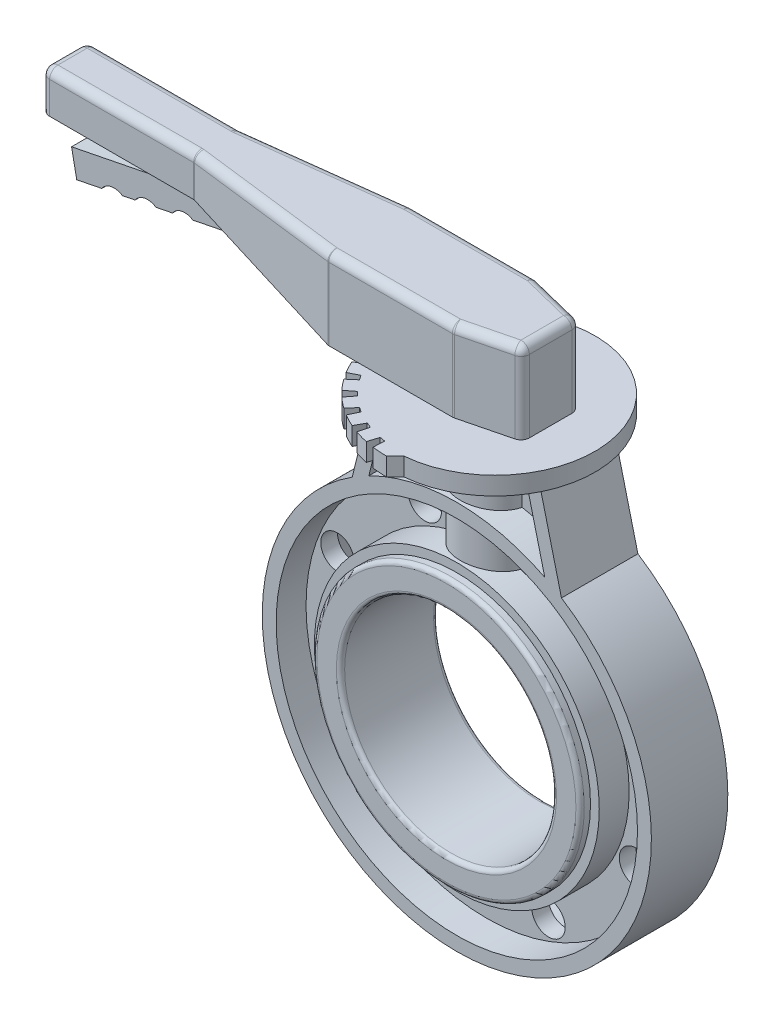
from build123d import *

# Parameters (mm, degrees)
CUT_EXTRUDE1_DEPTH       = 202.05969262883102
CUT_EXTRUDE1_DEPTH_BACK  = 202.05969262883102
SKETCH3_R                = 11.999999999999996
SKETCH3_R_2              = 12.000000000000002
SKETCH3_R_3              = 12.000000000000005
SKETCH5_R                = 72
SKETCH5_R_2              = 25
BOSS_EXTRUDE1_DEPTH      = 13
BOSS_EXTRUDE2_REACH      = 359.526
BOSS_EXTRUDE2_END_RADIUS = 102.50000000000001
SKETCH5_3_R              = 25
EXTRUDE_THIN1_DEPTH      = 27.5
EXTRUDE_THIN1_DEPTH_BACK = 27.5
BOSS_EXTRUDE3_DEPTH      = 5
FILLET1_R                = 3
BOSS_EXTRUDE4_DEPTH      = 13
CUT_EXTRUDE2_DEPTH       = 13
CIRPATTERN1_COUNT        = 7
CIRPATTERN1_ANGLE        = 70.00000000000016
BOSS_EXTRUDE5_DEPTH      = 58
CUT_EXTRUDE4_DEPTH       = 408.0479087281987
CUT_EXTRUDE4_DEPTH_BACK  = 408.0479087281987
BOSS_EXTRUDE6_DEPTH      = 6
FILLET2_R                = 6


with BuildPart() as part:
    # Sketch1 → Revolve1 (revolve)
    with BuildSketch(Plane(origin=(0, 0, 0), x_dir=(0, 0, -1), z_dir=(1, 0, 0)), mode=Mode.PRIVATE) as revolve1_sk:
        Polygon((-27.50000000000001, 82.49999999999999), (27.500000000000004, 82.50000000000001), (27.500000000000004, 102.50000000000001), (6.0000000000000036, 102.50000000000001), (6.0000000000000036, 130), (27.500000000000004, 130), (27.50000000000001, 140), (-27.50000000000001, 140), (-27.50000000000001, 130), (-6.000000000000014, 130), (-6.000000000000007, 102.50000000000001), (-27.50000000000001, 102.50000000000001), align=None)
    revolve(revolve1_sk.sketch.rotate(Axis((0, 0, 35), (0, 0, -1)), 90), axis=Axis((0, 0, 35), (0, 0, -1)))

    # Sketch3 → Cut-Extrude1 (cut, two sides: drawn at the far end of the back side and taken through both)
    with BuildSketch(Plane(origin=(0, 0, 0), x_dir=(-1, 0, 0), z_dir=(0, 0, -1)).offset(-CUT_EXTRUDE1_DEPTH_BACK)):
        with Locations((44.4869490124417, -107.4009956544371)):
            Circle(SKETCH3_R)
        with Locations((107.40099565443711, -44.486949012441656)):
            Circle(SKETCH3_R_2)
        with Locations((107.40099565443711, 44.486949012441706)):
            Circle(SKETCH3_R_3)
        with Locations((44.486949012441706, 107.40099565443711)):
            Circle(SKETCH3_R_2)
        with Locations((-44.48694901244171, 107.40099565443711)):
            Circle(SKETCH3_R)
        with Locations((-107.40099565443711, 44.48694901244169)):
            Circle(SKETCH3_R_3)
        with Locations((-107.40099565443711, -44.486949012441706)):
            Circle(SKETCH3_R_3)
        with Locations((-44.48694901244173, -107.4009956544371)):
            Circle(SKETCH3_R)
    extrude(amount=CUT_EXTRUDE1_DEPTH + CUT_EXTRUDE1_DEPTH_BACK, mode=Mode.SUBTRACT)



with BuildPart() as body_2:
    # Sketch2 → Revolve2 (revolve)
    with BuildSketch(Plane(origin=(0, 0, 0), x_dir=(0, 0, -1), z_dir=(1, 0, 0)), mode=Mode.PRIVATE) as revolve2_sk:
        Polygon((-27.50000000000001, 96.2), (-27.50000000000001, 82.49999999999999), (27.499999999999996, 82.5), (27.500000000000004, 96.2), (34.99999999999999, 96.2), (35, 76.2), (-35, 76.19999999999999), (-35, 96.2), align=None)
    revolve(revolve2_sk.sketch.rotate(Axis((0, 0, 35), (0, 0, -1)), 90), axis=Axis((0, 0, 35), (0, 0, -1)))

    # Fillet1
    fillet1_edges = [body_2.edges().sort_by_distance(p)[0] for p in [
        (-96.2, 2.026e-14, 35),
        (-76.19999999999999, -1.779e-14, 35),
        (-76.2, -1.779e-14, -35),
        (-96.2, 2.026e-14, -35),
    ]]
    fillet(fillet1_edges, radius=FILLET1_R)


with BuildPart() as body_3:
    # Sketch5 → Boss-Extrude1 (new body)
    # profile 1 of 2: a face of its own
    with BuildSketch(Plane(origin=(0, 181, 0), x_dir=(1, 0, 0), z_dir=(0, 1, 0))):
        with Locations(Location((0, 0, 0), (0, 0, 90))):
            Circle(SKETCH5_R)
        Circle(SKETCH5_R_2, mode=Mode.SUBTRACT)
    # profile 2 of 2: a face of its own
    with BuildSketch(Plane(origin=(0, 181, 0), x_dir=(1, 0, 0), z_dir=(0, 1, 0))):
        Circle(SKETCH5_R_2)
    extrude(amount=BOSS_EXTRUDE1_DEPTH)


with BuildPart() as body_4:
    # Boss-Extrude2: up to this cylinder (the profile starts outside it)
    boss_extrude2_end = Plane(origin=(0, 0, 0), z_dir=(0, 0, 1)) * Cylinder(BOSS_EXTRUDE2_END_RADIUS, 925.052, mode=Mode.PRIVATE)
    # Sketch5<3> → Boss-Extrude2 (new, up to the surface)
    with BuildSketch(Plane(origin=(0, 181, 0), x_dir=(1, 0, 0), z_dir=(0, 1, 0)), mode=Mode.PRIVATE) as boss_extrude2_sk1:
        with Locations(Location((0, 0, 0), (0, 0, 270))):
            Circle(SKETCH5_3_R)
    boss_extrude2_tool1 = extrude(boss_extrude2_sk1.sketch, amount=-BOSS_EXTRUDE2_REACH, mode=Mode.PRIVATE) - boss_extrude2_end
    add(boss_extrude2_tool1.solids().sort_by_distance((0, 181, 0))[0])


with BuildPart() as part_1:
    add(part.part)

    add(body_3.part)  # Extrude-Thin1 merges body 3
    # Sketch6 → Extrude-Thin1 (add, two sides: drawn at the far end of the back side and taken through both)
    with BuildSketch(Plane.XY.offset(-EXTRUDE_THIN1_DEPTH_BACK)):
        Polygon((-57.66969982811231, 188.70960947799833), (-75.43432003068894, 117.45960947799834), (-65.73136276792899, 115.04039052200166), (-47.96674256535234, 186.29039052200167), align=None)
        Polygon((47.96674256535234, 186.29039052200167), (65.73136276792899, 115.04039052200166), (75.43432003068894, 117.45960947799834), (57.66969982811231, 188.70960947799833), align=None)
    extrude(amount=EXTRUDE_THIN1_DEPTH + EXTRUDE_THIN1_DEPTH_BACK)


    add(body_4.part)  # Boss-Extrude3 merges body 4
    # Sketch8 → Boss-Extrude3 (add, symmetric)
    with BuildSketch(Plane.XY):
        with BuildLine():
            Line((-49.28578506846351, 181), (49.28578506846351, 181))
            Line((49.28578506846351, 181), (63.27707723152493, 124.88399215686385))
            ThreePointArc((63.27707723152493, 124.88399215686385), (1.63e-15, 139.99999999999994), (-63.27707723152494, 124.88399215686385))
            Line((-63.27707723152494, 124.88399215686385), (-49.28578506846351, 181))
        make_face()
    extrude(amount=BOSS_EXTRUDE3_DEPTH, both=True)

    # Sketch9 → Boss-Extrude4 (add)
    with BuildSketch(Plane(origin=(0, 194, 0), x_dir=(1, 0, 0), z_dir=(0, 1, 0))):
        with BuildLine():
            Line((-78, 0), (-71.72613634390713, 6.27386365609281))
            Line((-71.72613634390713, 6.27386365609281), (0, 0))
            Line((0, 0), (6.273863656092907, -71.72613634390716))
            Line((6.273863656092907, -71.72613634390716), (0, -78))
            ThreePointArc((0, -78), (-55.15432893255072, -55.154328932550705), (-78, 0))
        make_face()
    extrude(amount=-BOSS_EXTRUDE4_DEPTH)

    # Sketch11 → Cut-Extrude2 (cut)
    with BuildSketch(Plane(origin=(0, 194, 0), x_dir=(1, 0, 0), z_dir=(0, 1, 0))):
        with BuildLine():
            Line((-10.473497725883917, -77.29363392534927), (-10.090171618497848, -69.29782418452444))
            Line((-10.090171618497848, -69.29782418452444), (-14.030357058693376, -68.60866622231899))
            Line((-14.030357058693376, -68.60866622231899), (-16.383775886177204, -76.25989698204108))
            ThreePointArc((-16.383775886177204, -76.25989698204108), (-13.438580263006523, -76.83361608381271), (-10.473497725883917, -77.29363392534927))
        make_face()
    cut_extrude2 = extrude(amount=-CUT_EXTRUDE2_DEPTH, mode=Mode.SUBTRACT)

    # CirPattern1: Cut-Extrude2 ×7 about axis
    cirpattern1_axis = Axis((-5.13e-15, 0, -4.9e-15), (0, -1, 0))
    for i in range(1, CIRPATTERN1_COUNT):
        add(cut_extrude2.rotate(cirpattern1_axis, i * CIRPATTERN1_ANGLE / (CIRPATTERN1_COUNT - 1)), mode=Mode.SUBTRACT)


with BuildPart() as body_3_2:
    # Sketch12 → Boss-Extrude5 (new body)
    with BuildSketch(Plane(origin=(0, 194, 0), x_dir=(1, 0, 0), z_dir=(0, 1, 0))):
        Polygon((0, 30), (40.00000000000001, 20), (40.00000000000001, -20), (0, -30), (-90, -30), (-200, -16.5), (-310, -16.5), (-310, 16.5), (-200, 16.5), (-90, 30), align=None)
    extrude(amount=BOSS_EXTRUDE5_DEPTH)

    # Sketch13 → Cut-Extrude4 (cut, two sides: drawn at the far end of the back side and taken through both)
    with BuildSketch(Plane.XY.offset(-CUT_EXTRUDE4_DEPTH_BACK)):
        Polygon((-1476.3200249065999, 223.0000000000003), (-310, 223), (-200, 222.99999999999997), (-90, 194), (1037.7854798488363, -103.32526286923837), (737.532710531902, -2416.5606327592195), (-1776.5727942235342, -2090.2353698899806), align=None)
    extrude(amount=CUT_EXTRUDE4_DEPTH + CUT_EXTRUDE4_DEPTH_BACK, mode=Mode.SUBTRACT)

    # Fillet2
    # the kernel refuses this fillet: 6 mm, written as the material it adds along each edge
    with BuildSketch(Plane(origin=(-200, 222.99999999999997, 16.5), x_dir=(0.992553028087833, 0, 0.12181332617441075), z_dir=(0, 1, 0))) as fillet2_piece_1_section:
        with BuildLine():
            CenterArc((FILLET2_R * 0.061134295779, -FILLET2_R), FILLET2_R, 89.99999999999983, 6.99676635713422)
            Line((-FILLET2_R * 0.0606790303954, -FILLET2_R * 0.00744697191217), (0, 0))
            Line((0, 0), (FILLET2_R * 0.061134295779, 0))
        make_face()
    fillet2_piece_1 = extrude(amount=29.00000000000003, mode=Mode.PRIVATE)
    fillet2_piece_1 = split(fillet2_piece_1, bisect_by=Plane(origin=(-200.2351393860494, 223.06199129268572, 16.44095478162272), z_dir=(-0.2549259693050786, -0.9669605732261611, 0)), keep=Keep.TOP, mode=Mode.PRIVATE)
    add(fillet2_piece_1)
    with BuildSketch(Plane(origin=(-200, 222.08298556331533, 16.5), x_dir=(0.992553028087833, 0, 0.12181332617441075), z_dir=(0, 1, 0))) as fillet2_piece_2_section:
        with BuildLine():
            CenterArc((FILLET2_R * 0.061134295779, -FILLET2_R), FILLET2_R, 89.99999999999983, 6.99676635713422)
            Line((-FILLET2_R * 0.0606790303954, -FILLET2_R * 0.00744697191217), (0, 0))
            Line((0, 0), (FILLET2_R * 0.061134295779, 0))
        make_face()
    fillet2_piece_2 = extrude(amount=29.917014436684667, mode=Mode.PRIVATE)
    fillet2_piece_2 = split(fillet2_piece_2, bisect_by=Plane(origin=(-199.76184237625856, 222.9372129901045, 16.469899204384074), z_dir=(0.2549259693050786, 0.9669605732261611, 0)), keep=Keep.TOP, mode=Mode.PRIVATE)
    fillet2_piece_2 = split(fillet2_piece_2, bisect_by=Plane(origin=(-199.7538438713441, 222.99999999999997, 16.469899204384074), z_dir=(-2.7e-16, -1, 0)), keep=Keep.TOP, mode=Mode.PRIVATE)
    add(fillet2_piece_2)
    with BuildSketch(Plane(origin=(-200, 222.99999999999997, 16.5), x_dir=(0.992553028087833, 0, 0.12181332617441075), z_dir=(0, 1, 0))) as fillet2_piece_3_section:
        with BuildLine():
            CenterArc((FILLET2_R * 0.061134295779, -FILLET2_R), FILLET2_R, 89.99999999999983, 6.99676635713422)
            Line((-FILLET2_R * 0.0606790303954, -FILLET2_R * 0.00744697191217), (0, 0))
            Line((0, 0), (FILLET2_R * 0.061134295779, 0))
        make_face()
    fillet2_piece_3 = extrude(amount=29.00000000000003, mode=Mode.PRIVATE)
    fillet2_piece_3 = split(fillet2_piece_3, bisect_by=Plane(origin=(-203.5743169111466, 223.94231991293861, 16.4528211689396), z_dir=(0.2549259693050786, 0.9669605732261611, 0)), keep=Keep.TOP, mode=Mode.PRIVATE)
    add(fillet2_piece_3)
    with BuildSketch(Plane(origin=(-200, 222.99999999999997, -16.5), x_dir=(0.992553028087833, 0, -0.12181332617441075), z_dir=(0, 1, 0))) as fillet2_piece_4_section:
        with BuildLine():
            CenterArc((FILLET2_R * 0.061134295779, FILLET2_R), FILLET2_R, 263.00323364286595, 6.99676635713422)
            Line((-FILLET2_R * 0.0606790303954, FILLET2_R * 0.00744697191217), (0, 0))
            Line((0, 0), (FILLET2_R * 0.061134295779, 0))
        make_face()
    fillet2_piece_4 = extrude(amount=29.00000000000003, mode=Mode.PRIVATE)
    fillet2_piece_4 = split(fillet2_piece_4, bisect_by=Plane(origin=(-200.23513938604944, 223.06199129268575, -16.440954781622725), z_dir=(-0.2549259693050786, -0.9669605732261611, 0)), keep=Keep.TOP, mode=Mode.PRIVATE)
    add(fillet2_piece_4)
    with BuildSketch(Plane(origin=(-200, 222.08298556331533, -16.5), x_dir=(0.992553028087833, 0, -0.12181332617441075), z_dir=(0, 1, 0))) as fillet2_piece_5_section:
        with BuildLine():
            CenterArc((FILLET2_R * 0.061134295779, FILLET2_R), FILLET2_R, 263.00323364286595, 6.99676635713422)
            Line((-FILLET2_R * 0.0606790303954, FILLET2_R * 0.00744697191217), (0, 0))
            Line((0, 0), (FILLET2_R * 0.061134295779, 0))
        make_face()
    fillet2_piece_5 = extrude(amount=29.917014436684667, mode=Mode.PRIVATE)
    fillet2_piece_5 = split(fillet2_piece_5, bisect_by=Plane(origin=(-199.76184237625856, 222.9372129901045, -16.469899204384074), z_dir=(0.2549259693050786, 0.9669605732261611, 0)), keep=Keep.TOP, mode=Mode.PRIVATE)
    fillet2_piece_5 = split(fillet2_piece_5, bisect_by=Plane(origin=(-199.7538438713441, 222.99999999999997, -16.469899204384074), z_dir=(-2.7e-16, -1, 0)), keep=Keep.TOP, mode=Mode.PRIVATE)
    add(fillet2_piece_5)
    with BuildSketch(Plane(origin=(-200, 222.99999999999997, -16.5), x_dir=(0.992553028087833, 0, -0.12181332617441075), z_dir=(0, 1, 0))) as fillet2_piece_6_section:
        with BuildLine():
            CenterArc((FILLET2_R * 0.061134295779, FILLET2_R), FILLET2_R, 263.00323364286595, 6.99676635713422)
            Line((-FILLET2_R * 0.0606790303954, FILLET2_R * 0.00744697191217), (0, 0))
            Line((0, 0), (FILLET2_R * 0.061134295779, 0))
        make_face()
    fillet2_piece_6 = extrude(amount=29.00000000000003, mode=Mode.PRIVATE)
    fillet2_piece_6 = split(fillet2_piece_6, bisect_by=Plane(origin=(-203.57431691114664, 223.94231991293864, -16.452821168939604), z_dir=(0.2549259693050786, 0.9669605732261611, 0)), keep=Keep.TOP, mode=Mode.PRIVATE)
    add(fillet2_piece_6)
    # the kernel refuses this fillet: 6 mm, written as the material it takes off along each edge
    with BuildSketch(Plane(origin=(-304, 246, -10.5), x_dir=(0, 0, -1), z_dir=(0, 1, 0))) as fillet2_2_piece_1_section:
        Polygon((0, 0), (FILLET2_R, 0), (FILLET2_R, FILLET2_R), (0, FILLET2_R), align=None)
    fillet2_2_piece_1 = extrude(amount=FILLET2_R, mode=Mode.PRIVATE)
    fillet2_2_piece_1 = fillet2_2_piece_1 - Plane(origin=(-304, 246, -10.5), x_dir=(0.7071067811865475, 0, 0.7071067811865475), z_dir=(0, 1, 0)) * Sphere(FILLET2_R, mode=Mode.PRIVATE)
    add(fillet2_2_piece_1, mode=Mode.SUBTRACT)
    with BuildSketch(Plane(origin=(-304, 246, 10.5), x_dir=(0, 1, 0), z_dir=(0, 0, 1))) as fillet2_2_piece_2_section:
        Polygon((0, 0), (FILLET2_R, 0), (FILLET2_R, FILLET2_R), (0, FILLET2_R), align=None)
    fillet2_2_piece_2 = extrude(amount=FILLET2_R, mode=Mode.PRIVATE)
    fillet2_2_piece_2 = fillet2_2_piece_2 - Plane(origin=(-304, 246, 10.5), x_dir=(0.7071067811865475, -0.7071067811865475, 0), z_dir=(0, 0, 1)) * Sphere(FILLET2_R, mode=Mode.PRIVATE)
    add(fillet2_2_piece_2, mode=Mode.SUBTRACT)
    with BuildSketch(Plane(origin=(-0.7386337537059596, 246, -24), x_dir=(0, 0, -1), z_dir=(0, 1, 0))) as fillet2_2_piece_3_section:
        Polygon((0, 0), (FILLET2_R, 0), (FILLET2_R, -FILLET2_R * 0.123105625618), (FILLET2_R * 0.970142500145, -FILLET2_R * 0.242535625036), align=None)
    fillet2_2_piece_3 = extrude(amount=FILLET2_R, mode=Mode.PRIVATE)
    fillet2_2_piece_3 = fillet2_2_piece_3 - Plane(origin=(-0.7386337537059596, 246, -24), x_dir=(-0.12218326369570445, 0, 0.992507556682903), z_dir=(0, 1, 0)) * Sphere(FILLET2_R, mode=Mode.PRIVATE)
    add(fillet2_2_piece_3, mode=Mode.SUBTRACT)
    with BuildSketch(Plane(origin=(34, 246, -15.31534156157351), x_dir=(1, 0, 0), z_dir=(0, 1, 0))) as fillet2_2_piece_4_section:
        Polygon((0, 0), (FILLET2_R, 0), (FILLET2_R, FILLET2_R * 0.780776406404), (FILLET2_R * 0.242535625036, FILLET2_R * 0.970142500145), align=None)
    fillet2_2_piece_4 = extrude(amount=FILLET2_R, mode=Mode.PRIVATE)
    fillet2_2_piece_4 = fillet2_2_piece_4 - Plane(origin=(34, 246, -15.31534156157351), x_dir=(-0.7882054380161092, 0, 0.6154122094026357), z_dir=(0, 1, 0)) * Sphere(FILLET2_R, mode=Mode.PRIVATE)
    add(fillet2_2_piece_4, mode=Mode.SUBTRACT)
    with BuildSketch(Plane(origin=(34, 246, 15.31534156157351), x_dir=(0.24253562503633297, 0, 0.9701425001453321), z_dir=(0, 1, 0))) as fillet2_2_piece_5_section:
        Polygon((0, 0), (FILLET2_R, 1.5e-16), (FILLET2_R, FILLET2_R * 0.780776406404), (FILLET2_R * 0.242535625036, FILLET2_R * 0.970142500145), align=None)
    fillet2_2_piece_5 = extrude(amount=FILLET2_R, mode=Mode.PRIVATE)
    fillet2_2_piece_5 = fillet2_2_piece_5 - Plane(origin=(34, 246, 15.31534156157351), x_dir=(-0.7882054380161092, 0, -0.6154122094026357), z_dir=(0, 1, 0)) * Sphere(FILLET2_R, mode=Mode.PRIVATE)
    add(fillet2_2_piece_5, mode=Mode.SUBTRACT)
    with BuildSketch(Plane(origin=(-0.7386337537059546, 246, 24), x_dir=(0, 0, 1), z_dir=(0, 1, 0))) as fillet2_2_piece_6_section:
        Polygon((0, 0), (FILLET2_R, 0), (FILLET2_R, FILLET2_R * 0.123105625618), (FILLET2_R * 0.970142500145, FILLET2_R * 0.242535625036), align=None)
    fillet2_2_piece_6 = extrude(amount=FILLET2_R, mode=Mode.PRIVATE)
    fillet2_2_piece_6 = fillet2_2_piece_6 - Plane(origin=(-0.7386337537059546, 246, 24), x_dir=(-0.12218326369570445, 0, -0.992507556682903), z_dir=(0, 1, 0)) * Sphere(FILLET2_R, mode=Mode.PRIVATE)
    add(fillet2_2_piece_6, mode=Mode.SUBTRACT)
    with BuildSketch(Plane(origin=(-89.63319422532615, 246, 24), x_dir=(-0.1218133261744158, 0, 0.9925530280878324), z_dir=(0, 1, 0))) as fillet2_2_piece_7_section:
        Polygon((0, 0), (FILLET2_R, -4e-17), (FILLET2_R, FILLET2_R * 0.061134295779), (FILLET2_R * 0.992553028088, FILLET2_R * 0.121813326174), align=None)
    fillet2_2_piece_7 = extrude(amount=FILLET2_R, mode=Mode.PRIVATE)
    fillet2_2_piece_7 = fillet2_2_piece_7 - Plane(origin=(-89.63319422532615, 246, 24), x_dir=(0.06102037328699166, 0, -0.9981365207444902), z_dir=(0, 1, 0)) * Sphere(FILLET2_R, mode=Mode.PRIVATE)
    add(fillet2_2_piece_7, mode=Mode.SUBTRACT)
    with BuildSketch(Plane(origin=(-89.63319422532615, 246, -24), x_dir=(-0.1218133261744158, 0, -0.9925530280878324), z_dir=(0, 1, 0))) as fillet2_2_piece_8_section:
        Polygon((0, 0), (FILLET2_R, 4e-17), (FILLET2_R, -FILLET2_R * 0.061134295779), (FILLET2_R * 0.992553028088, -FILLET2_R * 0.121813326174), align=None)
    fillet2_2_piece_8 = extrude(amount=FILLET2_R, mode=Mode.PRIVATE)
    fillet2_2_piece_8 = fillet2_2_piece_8 - Plane(origin=(-89.63319422532615, 246, -24), x_dir=(0.06102037328699166, 0, 0.9981365207444902), z_dir=(0, 1, 0)) * Sphere(FILLET2_R, mode=Mode.PRIVATE)
    add(fillet2_2_piece_8, mode=Mode.SUBTRACT)
    with BuildSketch(Plane(origin=(-304, 252, -16.5), x_dir=(0, 0, 1), z_dir=(1, 0, 0)), Plane(origin=(-200.36680577467385, 252, 16.5), x_dir=(0, 0, -1), z_dir=(-1, 0, 0))) as fillet2_2_piece_9:
        with BuildLine():
            CenterArc((FILLET2_R, FILLET2_R), FILLET2_R, 180, 90)
            Line((0, FILLET2_R), (0, 0))
            Line((0, 0), (FILLET2_R, 0))
        make_face()
    extrude(amount=103.63319422532615, mode=Mode.SUBTRACT)
    with BuildSketch(Plane(origin=(-310, 252, 10.5), x_dir=(1, 0, 0), z_dir=(0, 0, -1))) as fillet2_2_piece_10:
        with BuildLine():
            CenterArc((FILLET2_R, FILLET2_R), FILLET2_R, 180, 90)
            Line((0, FILLET2_R), (0, 0))
            Line((0, 0), (FILLET2_R, 0))
        make_face()
    extrude(amount=20.999999999999996, mode=Mode.SUBTRACT)
    with BuildSketch(Plane(origin=(0, 192.15341561573507, -30), x_dir=(0.9701425001453317, 0, 0.2425356250363341), z_dir=(0, 1, 0))) as fillet2_2_piece_11:
        with BuildLine():
            CenterArc((FILLET2_R * 0.123105625618, -FILLET2_R), FILLET2_R, 90.00000000000006, 14.036243467926539)
            Line((-FILLET2_R * 0.119429999419, -FILLET2_R * 0.0298574998547), (0, 0))
            Line((0, 0), (FILLET2_R * 0.123105625618, -1e-17))
        make_face()
    extrude(amount=53.84658438426493, mode=Mode.SUBTRACT)
    with BuildSketch(Plane(origin=(40.00000000000001, 182.28835390393377, -20), x_dir=(-0.9701425001453319, 0, -0.24253562503633297), z_dir=(0, 1, 0))) as fillet2_2_piece_12:
        with BuildLine():
            CenterArc((FILLET2_R * 0.780776406404, FILLET2_R), FILLET2_R, 194.03624346792645, 75.96375653207349)
            Line((-FILLET2_R * 0.189366093741, FILLET2_R * 0.757464374964), (0, 0))
            Line((0, 0), (FILLET2_R * 0.780776406404, 1.1e-16))
        make_face()
    extrude(amount=63.71164609606623, mode=Mode.SUBTRACT)
    with BuildSketch(Plane(origin=(40.00000000000001, 182.28835390393377, 20), x_dir=(-0.970142500145332, 0, 0.24253562503633264), z_dir=(0, 1, 0))) as fillet2_2_piece_13:
        with BuildLine():
            CenterArc((FILLET2_R * 0.780776406404, -FILLET2_R), FILLET2_R, 90.00000000000006, 75.96375653207352)
            Line((-FILLET2_R * 0.189366093741, -FILLET2_R * 0.757464374964), (0, 0))
            Line((0, 0), (FILLET2_R * 0.780776406404, -1e-16))
        make_face()
    extrude(amount=63.71164609606623, mode=Mode.SUBTRACT)
    with BuildSketch(Plane(origin=(7.11e-15, 192.15341561573507, 30), x_dir=(-1, 0, 0), z_dir=(0, 1, 0))) as fillet2_2_piece_14:
        with BuildLine():
            CenterArc((FILLET2_R * 0.123105625618, -FILLET2_R), FILLET2_R, 90, 14.036243467926539)
            Line((-FILLET2_R * 0.119429999419, -FILLET2_R * 0.0298574998547), (0, 0))
            Line((0, 0), (FILLET2_R * 0.123105625618, 0))
        make_face()
    extrude(amount=53.84658438426493, mode=Mode.SUBTRACT)
    with BuildSketch(Plane(origin=(-90, 193.0829855633154, 30), x_dir=(-0.9925530280878324, 0, -0.12181332617441544), z_dir=(0, 1, 0))) as fillet2_2_piece_15:
        with BuildLine():
            CenterArc((FILLET2_R * 0.061134295779, -FILLET2_R), FILLET2_R, 89.99999999999996, 6.996766357134092)
            Line((-FILLET2_R * 0.0606790303954, -FILLET2_R * 0.00744697191217), (0, 0))
            Line((0, 0), (FILLET2_R * 0.061134295779, 0))
        make_face()
    extrude(amount=52.91701443668461, mode=Mode.SUBTRACT)
    with BuildSketch(Plane(origin=(-310, 208, 16.5), x_dir=(0, 0, -1), z_dir=(0, 1, 0))) as fillet2_2_piece_16:
        with BuildLine():
            CenterArc((FILLET2_R, -FILLET2_R), FILLET2_R, 90, 90)
            Line((0, -FILLET2_R), (0, 0))
            Line((0, 0), (FILLET2_R, 0))
        make_face()
    extrude(amount=38, mode=Mode.SUBTRACT)
    with BuildSketch(Plane(origin=(-310, 208, -16.5), x_dir=(1, 0, 0), z_dir=(0, 1, 0))) as fillet2_2_piece_17:
        with BuildLine():
            CenterArc((FILLET2_R, -FILLET2_R), FILLET2_R, 90, 90)
            Line((0, -FILLET2_R), (0, 0))
            Line((0, 0), (FILLET2_R, 0))
        make_face()
    extrude(amount=38, mode=Mode.SUBTRACT)
    with BuildSketch(Plane(origin=(-90, 193.0829855633154, -30), x_dir=(-0.9925530280878324, 0, 0.12181332617441544), z_dir=(0, 1, 0))) as fillet2_2_piece_18:
        with BuildLine():
            CenterArc((FILLET2_R * 0.061134295779, FILLET2_R), FILLET2_R, 263.00323364286595, 6.996766357134106)
            Line((-FILLET2_R * 0.0606790303954, FILLET2_R * 0.00744697191217), (0, 0))
            Line((0, 0), (FILLET2_R * 0.061134295779, 0))
        make_face()
    extrude(amount=52.91701443668461, mode=Mode.SUBTRACT)
    with BuildSketch(Plane(origin=(-90.36407418237265, 252, 29.955318168526993), x_dir=(0.12181332617441581, 0, -0.9925530280878324), z_dir=(-0.9925530280878324, 0, -0.1218133261744158))) as fillet2_2_piece_19:
        with BuildLine():
            CenterArc((FILLET2_R, FILLET2_R), FILLET2_R, 180, 90)
            Line((-1.8e-15, FILLET2_R), (0, 0))
            Line((0, 0), (FILLET2_R, 0))
        make_face()
    extrude(amount=110.09170144366847, mode=Mode.SUBTRACT)
    with BuildSketch(Plane(origin=(-0.7386337537059545, 252, 30), x_dir=(0, 0, -1), z_dir=(-1, 0, 0))) as fillet2_2_piece_20:
        with BuildLine():
            CenterArc((FILLET2_R, FILLET2_R), FILLET2_R, 180, 90)
            Line((0, FILLET2_R), (0, 0))
            Line((0, 0), (FILLET2_R, 0))
        make_face()
    extrude(amount=88.8945604716202, mode=Mode.SUBTRACT)
    with BuildSketch(Plane(origin=(35.455213750218014, 252, 21.136196562445498), x_dir=(-0.2425356250363329, 0, -0.970142500145332), z_dir=(-0.9701425001453319, 0, 0.2425356250363329))) as fillet2_2_piece_21:
        with BuildLine():
            CenterArc((FILLET2_R, FILLET2_R), FILLET2_R, 180, 90)
            Line((-5.17e-15, FILLET2_R), (0, 0))
            Line((0, 0), (FILLET2_R, 0))
        make_face()
    extrude(amount=35.80776406404416, mode=Mode.SUBTRACT)
    with BuildSketch(Plane(origin=(40.00000000000001, 252, -15.31534156157351), x_dir=(-1, 0, 0), z_dir=(0, 0, 1))) as fillet2_2_piece_22:
        with BuildLine():
            CenterArc((FILLET2_R, FILLET2_R), FILLET2_R, 180, 90)
            Line((7.11e-15, FILLET2_R), (0, 0))
            Line((0, 0), (FILLET2_R, 0))
        make_face()
    extrude(amount=30.630683123147016, mode=Mode.SUBTRACT)
    with BuildSketch(Plane(origin=(0.7165799965120373, 252, -29.82085500087199), x_dir=(0, -1, -1e-17), z_dir=(0.9701425001453319, 0, 0.2425356250363329))) as fillet2_2_piece_23:
        with BuildLine():
            CenterArc((FILLET2_R, -FILLET2_R), FILLET2_R, 90, 90)
            Line((-5e-17, -FILLET2_R), (0, 0))
            Line((0, 0), (FILLET2_R, 0))
        make_face()
    extrude(amount=35.80776406404416, mode=Mode.SUBTRACT)
    with BuildSketch(Plane(origin=(-89.63319422532615, 252, -30), x_dir=(0, 0, 1), z_dir=(1, 0, 0))) as fillet2_2_piece_24:
        with BuildLine():
            CenterArc((FILLET2_R, FILLET2_R), FILLET2_R, 180, 90)
            Line((0, FILLET2_R), (0, 0))
            Line((0, 0), (FILLET2_R, 0))
        make_face()
    extrude(amount=88.89456047162018, mode=Mode.SUBTRACT)
    with BuildSketch(Plane(origin=(-199.63592581762737, 252, -16.544681831473007), x_dir=(0.12181332617441581, 0, 0.9925530280878324), z_dir=(0.9925530280878324, 0, -0.1218133261744158))) as fillet2_2_piece_25:
        with BuildLine():
            CenterArc((FILLET2_R, FILLET2_R), FILLET2_R, 180, 90)
            Line((-3.53e-15, FILLET2_R), (0, 0))
            Line((0, 0), (FILLET2_R, 0))
        make_face()
    extrude(amount=110.09170144366847, mode=Mode.SUBTRACT)
    with BuildSketch(Plane(origin=(-200.36680577467385, 252, -22.5), x_dir=(0.12181332617441377, 0, 0.9925530280878326), z_dir=(0.9925530280878326, 0, -0.12181332617441377))) as fillet2_2_piece_26:
        with BuildLine():
            CenterArc((6.000000000000001 + FILLET2_R, FILLET2_R), FILLET2_R, 180, 90)
            Line((6.000000000000001, FILLET2_R), (6.000000000000001, 0))
            Line((6.000000000000001, 0), (6.000000000000001 + FILLET2_R, 0))
        make_face()
    revolve(axis=Axis((-200.36680577467385, 252, -22.5), (0, -1, 0)), revolution_arc=6.996766357134219, mode=Mode.SUBTRACT)
    with BuildSketch(Plane(origin=(-200.36680577467385, 252, 22.5), x_dir=(0.12181332617441377, 0, -0.9925530280878326), z_dir=(0.9925530280878326, 0, 0.12181332617441377))) as fillet2_2_piece_27:
        with BuildLine():
            CenterArc((6.000000000000001 + FILLET2_R, -FILLET2_R), FILLET2_R, 90, 90)
            Line((6.000000000000001, -FILLET2_R), (6.000000000000001, 0))
            Line((6.000000000000001, 0), (6.000000000000001 + FILLET2_R, 0))
        make_face()
    revolve(axis=Axis((-200.36680577467385, 252, 22.5), (0, 1, 0)), revolution_arc=6.996766357134219, mode=Mode.SUBTRACT)


with BuildPart() as body_4_2:
    # Sketch14 → Boss-Extrude6 (new, symmetric)
    with BuildSketch(Plane.XY):
        with BuildLine():
            Line((-298.7139817671994, 201.43250740042575), (-168.12491395972106, 227.43965226038998))
            Line((-168.12491395972106, 227.43965226038998), (-70.7364566117711, 201.4325074004259))
            Line((-70.7364566117711, 201.4325074004259), (-70.7364566117711, 173.76533201748558))
            Line((-70.7364566117711, 173.76533201748558), (-91.76350990280577, 173.76533201748558))
            Line((-91.76350990280577, 173.76533201748558), (-91.76350990280577, 187.59891970895572))
            Line((-91.76350990280577, 187.59891970895572), (-168.1249139597211, 207.99088556506396))
            Line((-168.1249139597211, 207.99088556506396), (-211.4854313275688, 199.35552829265353))
            ThreePointArc((-211.4854313275688, 199.35552829265353), (-219.3870504976485, 200.91723883622194), (-226.08748945545057, 196.44749129260921))
            Line((-226.08748945545057, 196.44749129260921), (-238.03571747316602, 194.0679713060303))
            ThreePointArc((-238.03571747316602, 194.0679713060303), (-246.12825846983975, 195.69375772625892), (-252.9805042921821, 191.09167901580247))
            Line((-252.9805042921821, 191.09167901580247), (-262.0792824624055, 189.27963421071556))
            ThreePointArc((-262.0792824624055, 189.27963421071556), (-270.13617454515065, 190.87061017008776), (-276.96882761737373, 186.31434343832785))
            Line((-276.96882761737373, 186.31434343832785), (-294.988470668252, 182.72568571209362))
            Line((-294.988470668252, 182.72568571209362), (-298.7139817671994, 201.43250740042575))
        make_face()
    extrude(amount=BOSS_EXTRUDE6_DEPTH, both=True)


solid = Compound([body_2.part, part_1.part, body_3_2.part, body_4_2.part])
